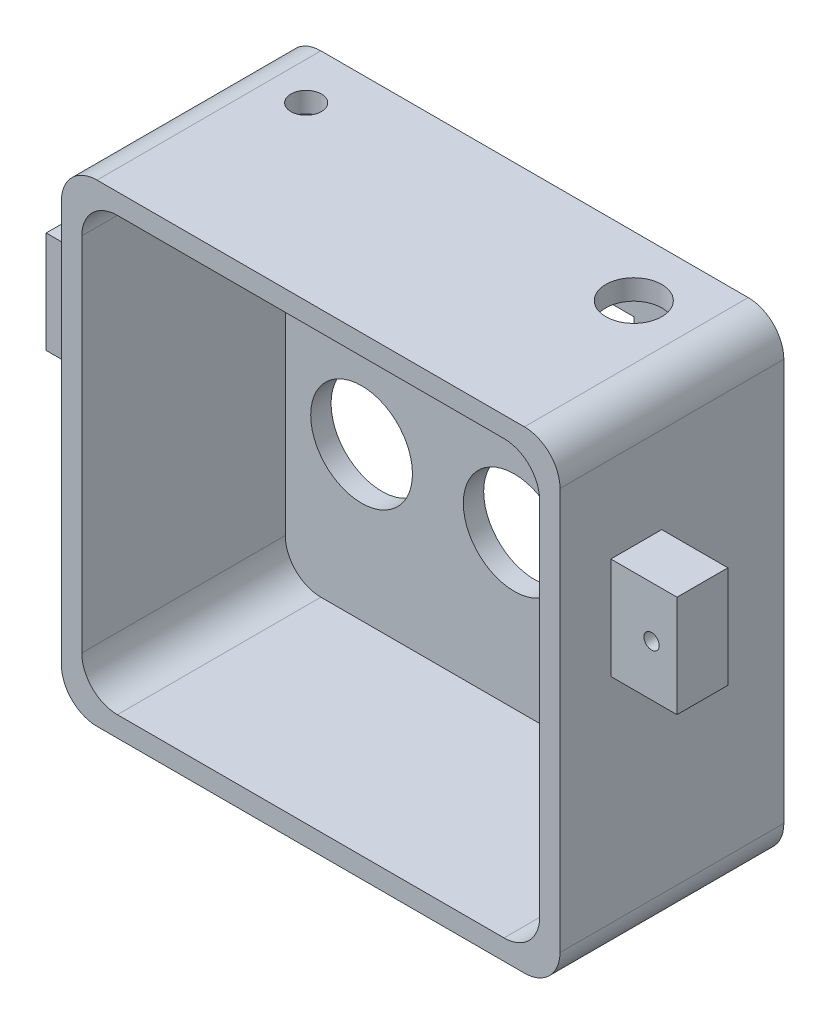
from build123d import *

# Parameters (mm, degrees)
SKETCH1_W           = 98
SKETCH1_H           = 93
BOSS_EXTRUDE1_DEPTH = 44
SHELL1_T            = -4
SKETCH2_R           = 10
CUT_EXTRUDE1_DEPTH  = 84.674059395
SKETCH2_5_R         = 10
CUT_EXTRUDE2_DEPTH  = 10
SKETCH2_6_R         = 10
CUT_EXTRUDE3_DEPTH  = 10
FILLET8_R           = 7
FILLET9_R           = 7
FILLET10_R          = 7
FILLET11_R          = 7
SKETCH9_W           = 10
SKETCH9_H           = 20
BOSS_EXTRUDE4_DEPTH = 13
FILLET12_R          = 7
FILLET14_R          = 7
FILLET15_R          = 7
SKETCH5_W           = 10
SKETCH5_H           = 20
BOSS_EXTRUDE5_DEPTH = 13
SKETCH10_R          = 1.5
CUT_EXTRUDE5_DEPTH  = 10
FILLET19_R          = 7
SKETCH15_R          = 5.5
CUT_EXTRUDE11_DEPTH = 10
SKETCH16_R          = 3
CUT_EXTRUDE12_DEPTH = 10
SKETCH13_W          = 47
SKETCH13_H          = 32
CUT_EXTRUDE13_DEPTH = 10


with BuildPart() as part:
    # Sketch1 → Boss-Extrude1 (new body)
    with BuildSketch(Plane.XY):
        with Locations((-0.276836158, 4.853107345)):
            Rectangle(SKETCH1_W, SKETCH1_H)
    extrude(amount=BOSS_EXTRUDE1_DEPTH)

    # Shell1
    shell1_openings = [part.faces().sort_by_distance(p)[0] for p in [
        (-0.276836158, 4.853107345, 44),
    ]]
    offset(amount=SHELL1_T, openings=shell1_openings, kind=Kind.INTERSECTION)

    # Sketch2 → Cut-Extrude1 (cut, through all)
    with BuildSketch(Plane(origin=(0, 0, 0), x_dir=(-1, 0, 0), z_dir=(0, 0, -1))):
        with Locations((-29.723163842, -7.646892655)):
            Circle(SKETCH2_R)
    extrude(amount=-CUT_EXTRUDE1_DEPTH, mode=Mode.SUBTRACT)

    # Sketch2<5> → Cut-Extrude2 (cut)
    with BuildSketch(Plane(origin=(0, 0, 0), x_dir=(-1, 0, 0), z_dir=(0, 0, -1))):
        with Locations((0.276836158, -7.646892655)):
            Circle(SKETCH2_5_R)
    extrude(amount=-CUT_EXTRUDE2_DEPTH, mode=Mode.SUBTRACT)

    # Sketch2<6> → Cut-Extrude3 (cut)
    with BuildSketch(Plane(origin=(0, 0, 0), x_dir=(-1, 0, 0), z_dir=(0, 0, -1))):
        with Locations((30.276836158, -7.646892655)):
            Circle(SKETCH2_6_R)
    extrude(amount=-CUT_EXTRUDE3_DEPTH, mode=Mode.SUBTRACT)

    # Fillet8
    fillet8_edges = [part.edges().sort_by_distance(p)[0] for p in [
        (-45.276836158, 47.353107345, 24),
    ]]
    fillet(fillet8_edges, radius=FILLET8_R)

    # Fillet9
    fillet9_edges = [part.edges().sort_by_distance(p)[0] for p in [
        (44.723163842, 47.353107345, 24),
    ]]
    fillet(fillet9_edges, radius=FILLET9_R)

    # Fillet10
    fillet10_edges = [part.edges().sort_by_distance(p)[0] for p in [
        (-45.276836158, -37.646892655, 24),
    ]]
    fillet(fillet10_edges, radius=FILLET10_R)

    # Fillet11
    fillet11_edges = [part.edges().sort_by_distance(p)[0] for p in [
        (44.723163842, -37.646892655, 24),
    ]]
    fillet(fillet11_edges, radius=FILLET11_R)

    # Sketch9 → Boss-Extrude4 (add)
    with BuildSketch(Plane.ZY.offset(49.276836158)):
        with Locations((29, 17.353107345)):
            Rectangle(SKETCH9_W, SKETCH9_H)
    extrude(amount=BOSS_EXTRUDE4_DEPTH)

    # Fillet12
    fillet12_edges = [part.edges().sort_by_distance(p)[0] for p in [
        (-49.276836158, 51.353107345, 22),
    ]]
    fillet(fillet12_edges, radius=FILLET12_R)

    # Fillet14
    fillet14_edges = [part.edges().sort_by_distance(p)[0] for p in [
        (48.723163842, -41.646892655, 22),
    ]]
    fillet(fillet14_edges, radius=FILLET14_R)

    # Fillet15
    fillet15_edges = [part.edges().sort_by_distance(p)[0] for p in [
        (-49.276836158, -41.646892655, 22),
    ]]
    fillet(fillet15_edges, radius=FILLET15_R)

    # Sketch5 → Boss-Extrude5 (add)
    with BuildSketch(Plane(origin=(48.723163842, 0, 0), x_dir=(0, 0, -1), z_dir=(1, 0, 0))):
        with Locations((-29, 17.353107345)):
            Rectangle(SKETCH5_W, SKETCH5_H)
    extrude(amount=BOSS_EXTRUDE5_DEPTH)

    # Sketch10 → Cut-Extrude5 (cut)
    with BuildSketch(Plane.XY.offset(34)):
        with Locations((-57.276836158, 17.353107345)):
            Circle(SKETCH10_R)
        with Locations((56.723163842, 17.353107345)):
            Circle(SKETCH10_R)
    extrude(amount=-CUT_EXTRUDE5_DEPTH, mode=Mode.SUBTRACT)

    # Fillet19
    fillet19_edges = [part.edges().sort_by_distance(p)[0] for p in [
        (48.723163842, 51.353107345, 22),
    ]]
    fillet(fillet19_edges, radius=FILLET19_R)

    # Sketch15 → Cut-Extrude11 (cut)
    with BuildSketch(Plane(origin=(0, 51.353107345, 0), x_dir=(1, 0, 0), z_dir=(0, 1, 0))):
        with Locations((30.982744471, -11.754384944)):
            Circle(SKETCH15_R)
    extrude(amount=-CUT_EXTRUDE11_DEPTH, mode=Mode.SUBTRACT)

    # Sketch16 → Cut-Extrude12 (cut)
    with BuildSketch(Plane(origin=(0, 51.353107345, 0), x_dir=(1, 0, 0), z_dir=(0, 1, 0))):
        with Locations((-34.881923744, -10.290725651)):
            Circle(SKETCH16_R)
    extrude(amount=-CUT_EXTRUDE12_DEPTH, mode=Mode.SUBTRACT)

    # Sketch13 → Cut-Extrude13 (cut)
    with BuildSketch(Plane(origin=(0, 0, 0), x_dir=(-1, 0, 0), z_dir=(0, 0, -1))):
        with Locations((0.276836158, 24.853107345)):
            Rectangle(SKETCH13_W, SKETCH13_H)
    extrude(amount=-CUT_EXTRUDE13_DEPTH, mode=Mode.SUBTRACT)


solid = part.part
